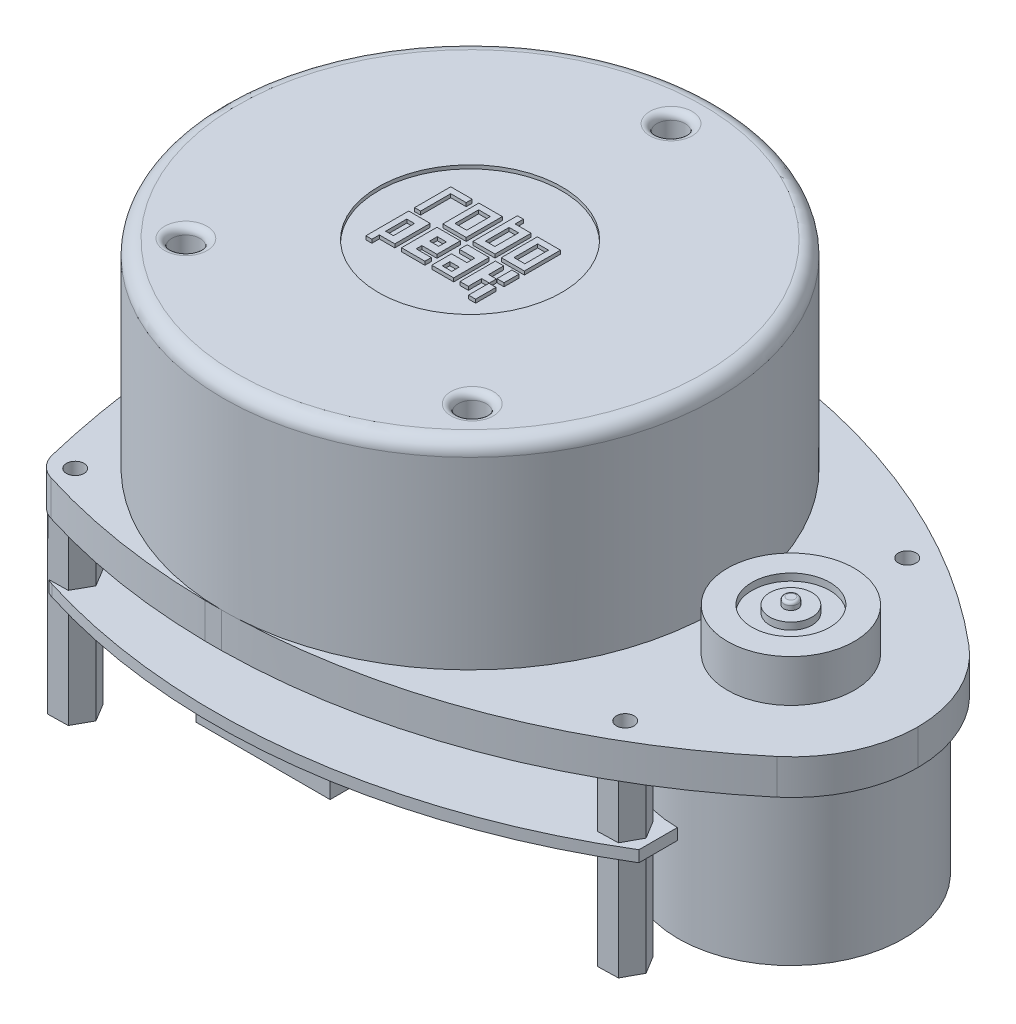
from build123d import *

# Parameters (mm, degrees)
SKETCH_1_W          = 98.5
SKETCH_1_H          = 70
EXTRUDE_1_DEPTH     = 5
SKETCH_2_R          = 35
EXTRUDE_2_DEPTH     = 28.1
SKETCH_3_R          = 2
CUT_EXTRUDE_1_DEPTH = 5
FILLET_1_R          = 2
FILLET_2_R          = 1
SKETCH_4_R          = 13
SKETCH_4_W          = 3.316540618
SKETCH_4_H          = 5.120069114
SKETCH_4_W_2        = 3.276095001
SKETCH_4_W_3        = 1.001370982
SKETCH_4_H_2        = 2.121481923
SKETCH_4_H_3        = 2.893302243
SKETCH_4_W_4        = 1.096399653
SKETCH_4_H_4        = 2.99297568
SKETCH_4_W_5        = 1.536933457
SKETCH_4_H_5        = 3.356986235
SKETCH_4_W_6        = 1.658270309
SKETCH_4_W_7        = 1.334705371
SKETCH_4_H_6        = 1.05158605
SKETCH_4_W_8        = 1.294259754
SKETCH_4_H_7        = 1.092031667
CUT_EXTRUDE_3_DEPTH = 0.5
SKETCH_5_R          = 1.25
CUT_EXTRUDE_4_DEPTH = 5
SKETCH_6_R          = 9
EXTRUDE_3_DEPTH     = 7
CUT_EXTRUDE_START   = -1
SKETCH_7_R          = 9
SKETCH_7_R_2        = 0.99350654
CUT_EXTRUDE_5_DEPTH = 1
SKETCH_8_R          = 5.521677929
SKETCH_8_R_2        = 3.001097475
CUT_EXTRUDE_6_DEPTH = 1
FILLET_3_R          = 0.4
SKETCH_9_R          = 16
EXTRUDE_4_DEPTH     = 27
EXTRUDE_5_DEPTH     = 24.6
SKETCH_11_R         = 26
EXTRUDE_6_DEPTH     = 8
FILLET_4_R          = 1
SKETCH_12_W         = 106.251501727
SKETCH_12_H         = 75.565901032
CUT_EXTRUDE_7_DEPTH = 8
FILLET_5_R          = 100
EXTRUDE_START       = 8
EXTRUDE_7_DEPTH     = 1.6
SKETCH_14_W         = 20
SKETCH_14_H         = 5
EXTRUDE_8_DEPTH     = 6
CHAMFER_1_SIZE      = 1


with BuildPart() as part:
    # Эскиз1 → Бобышка-Вытянуть1 (new body)
    with BuildSketch(Plane(origin=(0, 0, 0), x_dir=(1, 0, 0), z_dir=(0, 1, 0))):
        Rectangle(SKETCH_1_W, SKETCH_1_H)
    extrude(amount=EXTRUDE_1_DEPTH)

    # Эскиз2 → Бобышка-Вытянуть2 (add)
    with BuildSketch(Plane(origin=(0, 5, 0), x_dir=(1, 0, 0), z_dir=(0, 1, 0))):
        with Locations(Location((-14.25, 0, 0), (0, 0, 270))):
            Circle(SKETCH_2_R)
    extrude(amount=EXTRUDE_2_DEPTH)

    # Эскиз3 → Вырез-Вытянуть1 (cut)
    with BuildSketch(Plane(origin=(0, 33.1, 0), x_dir=(1, 0, 0), z_dir=(0, 1, 0))):
        with Locations(Location((-14.25, 28.5, 0), (0, 0, 270))):
            Circle(SKETCH_3_R)
        with Locations(Location((-34.553940504, -20, 0), (0, 0, 270))):
            Circle(SKETCH_3_R)
        with Locations(Location((6.053940504, -20, 0), (0, 0, 270))):
            Circle(SKETCH_3_R)
    extrude(amount=-CUT_EXTRUDE_1_DEPTH, mode=Mode.SUBTRACT)

    # Скругление1
    fillet_1_edges = [part.edges().sort_by_distance(p)[0] for p in [
        (-14.25, 33.1, -35),
    ]]
    fillet(fillet_1_edges, radius=FILLET_1_R)

    # Скругление2
    fillet_2_edges = [part.edges().sort_by_distance(p)[0] for p in [
        (-14.25, 33.1, -30.5),
        (-34.553940504, 33.1, 18),
        (6.053940504, 33.1, 18),
    ]]
    fillet(fillet_2_edges, radius=FILLET_2_R)

    # Эскиз4 → Вырез-Вытянуть3 (cut)
    # profile 1 of 7: a face of its own
    with BuildSketch(Plane(origin=(0, 33.1, 0), x_dir=(1, 0, 0), z_dir=(0, 1, 0))):
        with Locations(Location((-14.25, 0, 0), (0, 0, 270))):
            Circle(SKETCH_4_R)
        Polygon((-22.115166942, -6.914876839), (-22.115166942, -0.831627154), (-19.0735421, -0.831627154), (-19.0735421, -5.853844917), (-21.266341405, -5.853844917), (-21.266341405, -6.914876839), align=None, mode=Mode.SUBTRACT)
        Polygon((-22.115166942, 0), (-22.115166942, 5.120069114), (-19.0735421, 5.120069114), (-19.0735421, 4.27071115), (-21.266341405, 4.27071115), (-21.266341405, 0), align=None, mode=Mode.SUBTRACT)
        Polygon((-13.829606569, 0), (-13.829606569, 6.292992015), (-12.980248606, 6.292992015), (-12.980248606, 5.120069114), (-10.715294037, 5.120069114), (-10.715294037, 0), align=None, mode=Mode.SUBTRACT)
        with Locations((-16.458571693, 2.560034557)):
            Rectangle(SKETCH_4_W, SKETCH_4_H, mode=Mode.SUBTRACT)
        with Locations((-8.187442955, 2.560034557)):
            Rectangle(SKETCH_4_W_2, SKETCH_4_H, mode=Mode.SUBTRACT)
        with Locations((-7.050080946, -1.825090787)):
            Rectangle(SKETCH_4_W_3, SKETCH_4_H_2, mode=Mode.SUBTRACT)
        with Locations((-7.050080946, -5.468225718)):
            Rectangle(SKETCH_4_W_3, SKETCH_4_H_3, mode=Mode.SUBTRACT)
        Polygon((-9.825490456, -0.831627154), (-8.643651064, -0.831627154), (-8.643651064, -2.960833634), (-7.550766437, -2.960833634), (-7.550766437, -3.957287265), (-8.643651064, -3.957287265), (-8.643651064, -5.853844917), (-9.825490456, -5.853844917), align=None, mode=Mode.SUBTRACT)
        Polygon((-13.829606569, -0.831627154), (-10.715294037, -0.831627154), (-10.715294037, -5.853844917), (-13.829606569, -5.853844917), (-13.829606569, -3.04994558), (-11.645543235, -3.04994558), (-11.645543235, -1.940786367), (-13.829606569, -1.940786367), align=None, mode=Mode.SUBTRACT)
        Polygon((-18.116842002, -0.831627154), (-14.800301384, -0.831627154), (-14.800301384, -4.141977247), (-16.943919101, -4.141977247), (-16.943919101, -4.950889593), (-14.800301384, -4.950889593), (-14.800301384, -5.853844917), (-18.116842002, -5.853844917), align=None, mode=Mode.SUBTRACT)
    # profile 2 of 7: a face of its own
    with BuildSketch(Plane(origin=(0, 33.1, 0), x_dir=(1, 0, 0), z_dir=(0, 1, 0))):
        with Locations((-20.718141579, -3.454401753)):
            Rectangle(SKETCH_4_W_4, SKETCH_4_H_4)
    # profile 3 of 7: a face of its own
    with BuildSketch(Plane(origin=(0, 33.1, 0), x_dir=(1, 0, 0), z_dir=(0, 1, 0))):
        with Locations((-8.167220148, 2.592218033)):
            Rectangle(SKETCH_4_W_5, SKETCH_4_H_5)
    # profile 4 of 7: a face of its own
    with BuildSketch(Plane(origin=(0, 33.1, 0), x_dir=(1, 0, 0), z_dir=(0, 1, 0))):
        with Locations((-16.478794502, 2.592218033)):
            Rectangle(SKETCH_4_W_6, SKETCH_4_H_5)
    # profile 5 of 7: a face of its own
    with BuildSketch(Plane(origin=(0, 33.1, 0), x_dir=(1, 0, 0), z_dir=(0, 1, 0))):
        with Locations((-12.312895921, 2.592218033)):
            Rectangle(SKETCH_4_W_7, SKETCH_4_H_5)
    # profile 6 of 7: a face of its own
    with BuildSketch(Plane(origin=(0, 33.1, 0), x_dir=(1, 0, 0), z_dir=(0, 1, 0))):
        with Locations((-12.312895921, -4.667770272)):
            Rectangle(SKETCH_4_W_7, SKETCH_4_H_6)
    # profile 7 of 7: a face of its own
    with BuildSketch(Plane(origin=(0, 33.1, 0), x_dir=(1, 0, 0), z_dir=(0, 1, 0))):
        with Locations((-16.296789224, -2.503929746)):
            Rectangle(SKETCH_4_W_8, SKETCH_4_H_7)
    extrude(amount=-CUT_EXTRUDE_3_DEPTH, mode=Mode.SUBTRACT)

    # Эскиз5 → Вырез-Вытянуть4 (cut)
    with BuildSketch(Plane(origin=(0, 5, 0), x_dir=(1, 0, 0), z_dir=(0, 1, 0))):
        with Locations(Location((-42.25, 28, 0), (0, 0, 270))):
            Circle(SKETCH_5_R)
        with Locations(Location((27.75, 20, 0), (0, 0, 270))):
            Circle(SKETCH_5_R)
        with Locations(Location((27.75, -20, 0), (0, 0, 90))):
            Circle(SKETCH_5_R)
        with Locations(Location((-42.25, -28, 0), (0, 0, 90))):
            Circle(SKETCH_5_R)
    extrude(amount=-CUT_EXTRUDE_4_DEPTH, mode=Mode.SUBTRACT)

    # Эскиз6 → Бобышка-Вытянуть3 (add)
    with BuildSketch(Plane(origin=(0, 5, 0), x_dir=(1, 0, 0), z_dir=(0, 1, 0))):
        with Locations(Location((31.25, 0, 0), (0, 0, 270))):
            Circle(SKETCH_6_R)
    extrude(amount=EXTRUDE_3_DEPTH)

    # Эскиз7 → Вырез-Вытянуть5 (cut)
    with BuildSketch(Plane(origin=(0, 12, 0), x_dir=(1, 0, 0), z_dir=(0, 1, 0)).offset(CUT_EXTRUDE_START)):
        with Locations(Location((31.25, 0, 0), (0, 0, 270))):
            Circle(SKETCH_7_R)
        with Locations(Location((31.25, 0, 0), (0, 0, 270))):
            Circle(SKETCH_7_R_2, mode=Mode.SUBTRACT)
    extrude(amount=CUT_EXTRUDE_5_DEPTH, mode=Mode.SUBTRACT)

    # Эскиз8 → Вырез-Вытянуть6 (cut)
    with BuildSketch(Plane(origin=(0, 11, 0), x_dir=(1, 0, 0), z_dir=(0, 1, 0))):
        with Locations(Location((31.25, 0, 0), (0, 0, 270))):
            Circle(SKETCH_8_R)
        with Locations(Location((31.25, 0, 0), (0, 0, 270))):
            Circle(SKETCH_8_R_2, mode=Mode.SUBTRACT)
    extrude(amount=-CUT_EXTRUDE_6_DEPTH, mode=Mode.SUBTRACT)

    # Скругление3
    fillet_3_edges = [part.edges().sort_by_distance(p)[0] for p in [
        (31.25, 12, -0.99350654),
    ]]
    fillet(fillet_3_edges, radius=FILLET_3_R)

    # Эскиз9 → Бобышка-Вытянуть4 (add)
    with BuildSketch(Plane(origin=(0, 5, 0), x_dir=(1, 0, 0), z_dir=(0, 1, 0))):
        with Locations(Location((31.25, 0, 0), (0, 0, 270))):
            Circle(SKETCH_9_R)
    extrude(amount=-EXTRUDE_4_DEPTH)

    # Эскиз10 → Бобышка-Вытянуть5 (add)
    with BuildSketch(Plane.XZ):
        Polygon((-40.854614908, 25.472900125), (-39.363774764, 27.944889), (-40.759159856, 30.471988875), (-43.645385092, 30.527099875), (-45.136225236, 28.055111), (-43.740840144, 25.528011125), align=None)
        Polygon((29.257133708, 22.462088812), (26.371335397, 22.536260484), (24.864201688, 20.074171672), (26.242866292, 17.537911188), (29.128664603, 17.463739516), (30.635798312, 19.925828328), align=None)
        Polygon((30.635798312, -19.925828328), (29.257133708, -22.462088812), (26.371335397, -22.536260484), (24.864201688, -20.074171672), (26.242866292, -17.537911188), (29.128664603, -17.463739516), align=None)
        Polygon((-43.740840144, -25.528011125), (-40.854614908, -25.472900125), (-39.363774764, -27.944889), (-40.759159856, -30.471988875), (-43.645385092, -30.527099875), (-45.136225236, -28.055111), align=None)
    extrude(amount=EXTRUDE_5_DEPTH)

    # Эскиз11 → Бобышка-Вытянуть6 (add)
    with BuildSketch(Plane(origin=(0, 5, 0), x_dir=(1, 0, 0), z_dir=(0, 1, 0))):
        with Locations(Location((-14.25, 0, 0), (0, 0, 270))):
            Circle(SKETCH_11_R)
    extrude(amount=-EXTRUDE_6_DEPTH)

    # Скругление4
    fillet_4_edges = [part.edges().sort_by_distance(p)[0] for p in [
        (-14.25, -3, -26),
    ]]
    fillet(fillet_4_edges, radius=FILLET_4_R)

    # Эскиз12 → Вырез-Вытянуть7 (cut)
    with BuildSketch(Plane(origin=(0, 5, 0), x_dir=(1, 0, 0), z_dir=(0, 1, 0))):
        with Locations((-0.925367694, -0.052186396)):
            Rectangle(SKETCH_12_W, SKETCH_12_H)
        with BuildLine():
            ThreePointArc((-49.25, 0), (-48.116981176, 14.083966884), (-45.528607092, 27.974329531))
            ThreePointArc((-45.528607092, 27.974329531), (-44.561596332, 29.769996926), (-42.834972324, 30.855492545))
            ThreePointArc((-42.834972324, 30.855492545), (2.249574036, 33.221442581), (42.908955543, 13.599293477))
            ThreePointArc((42.908955543, 13.599293477), (47.577997957, 7.498372972), (49.25, 0))
            ThreePointArc((49.25, 0), (47.577997957, -7.498372972), (42.908955543, -13.599293477))
            ThreePointArc((42.908955543, -13.599293477), (2.249574036, -33.221442581), (-42.834972324, -30.855492545))
            ThreePointArc((-42.834972324, -30.855492545), (-44.561596332, -29.769996926), (-45.528607092, -27.974329531))
            ThreePointArc((-45.528607092, -27.974329531), (-48.116981176, -14.083966884), (-49.25, 0))
        make_face(mode=Mode.SUBTRACT)
    extrude(amount=-CUT_EXTRUDE_7_DEPTH, mode=Mode.SUBTRACT)

    # Скругление5
    # the kernel refuses this fillet: 100 mm, written as the material it takes off along each edge
    with BuildSketch(Plane(origin=(-49.25, 5, 0), x_dir=(0.06766370453174418, 0, 0.9977081853372963), z_dir=(0, -1, 0))) as fillet_5_piece_1:
        with BuildLine():
            CenterArc((6.776645039, -99.922318338), FILLET_5_R, 87.741474483, 12.276669201)
            ThreePointArc((-10.619357471, -1.44704684), (-5.323940761, -0.618859533), (0, 0))
            ThreePointArc((0, 0), (5.358747467, 0.105631125), (10.717494933, 0))
        make_face()
    extrude(amount=31.793737334, mode=Mode.SUBTRACT)

    # Эскиз13 → Бобышка-Вытянуть7 (add)
    with BuildSketch(Plane.XZ.offset(EXTRUDE_START)):
        with BuildLine():
            Line((31.553634402, 21.860321538), (31.553634402, 16.4))
            ThreePointArc((31.553634402, 16.4), (15.153634402, 0), (31.553634402, -16.4))
            Line((31.553634402, -16.4), (31.553634402, -21.860321538))
            ThreePointArc((31.553634402, -21.860321538), (-4.596615235, -34.347840749), (-42.683124513, -30.855492545))
            ThreePointArc((-42.683124513, -30.855492545), (-44.409748521, -29.769996926), (-45.37675928, -27.974329531))
            ThreePointArc((-45.37675928, -27.974329531), (-47.965133365, -14.083966884), (-49.098152188, 0))
            ThreePointArc((-49.098152188, 0), (-47.965133365, 14.083966884), (-45.37675928, 27.974329531))
            ThreePointArc((-45.37675928, 27.974329531), (-44.409748521, 29.769996926), (-42.683124513, 30.855492545))
            ThreePointArc((-42.683124513, 30.855492545), (-4.596615235, 34.347840749), (31.553634402, 21.860321538))
        make_face()
    extrude(amount=EXTRUDE_7_DEPTH)

    # Эскиз14 → Бобышка-Вытянуть8 (add)
    with BuildSketch(Plane.XZ.offset(9.6)):
        with Locations((-14.098152188, 27.5)):
            Rectangle(SKETCH_14_W, SKETCH_14_H)
    extrude(amount=EXTRUDE_8_DEPTH)

    # Фаска1
    chamfer_1_edges = [part.edges().sort_by_distance(p)[0] for p in [
        (-24.098152188, -12.6, 30),
    ]]
    chamfer(chamfer_1_edges, length=CHAMFER_1_SIZE)


solid = part.part
